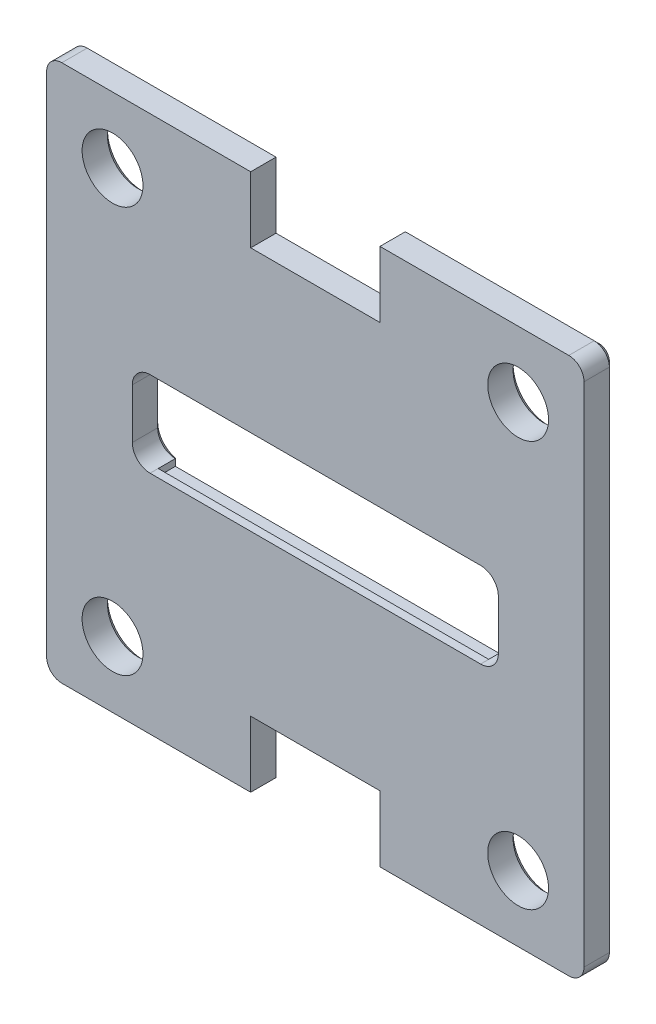
from build123d import *

# Parameters (mm, degrees)
SKETCH1_R           = 3
BOSS_EXTRUDE1_DEPTH = 3
SKETCH2_W           = 32.6
SKETCH2_H           = 9.75
CUT_EXTRUDE1_DEPTH  = 2.2
CHAMFER1_SIZE       = 0.5


with BuildPart() as part:
    # Sketch1 → Boss-Extrude1 (new body)
    with BuildSketch(Plane(origin=(0, 0, 0), x_dir=(0, 1, 0), z_dir=(0, 0, 1))):
        with BuildLine():
            Line((-26.5, 25), (-26.5, 6.375))
            Line((-26.5, 6.375), (-26, 6.375))
            Line((-26, 6.375), (-20, 6.375))
            Line((-20, 6.375), (-20, -6.375))
            Line((-20, -6.375), (-26, -6.375))
            Line((-26, -6.375), (-26.5, -6.375))
            Line((-26.5, -6.375), (-26.5, -25))
            ThreePointArc((-26.5, -25), (-26.060660172, -26.060660172), (-25, -26.5))
            Line((-25, -26.5), (25, -26.5))
            ThreePointArc((25, -26.5), (26.060660172, -26.060660172), (26.5, -25))
            Line((26.5, -25), (26.5, -6.375))
            Line((26.5, -6.375), (26, -6.375))
            Line((26, -6.375), (20, -6.375))
            Line((20, -6.375), (20, 6.375))
            Line((20, 6.375), (26, 6.375))
            Line((26, 6.375), (26.5, 6.375))
            Line((26.5, 6.375), (26.5, 25))
            ThreePointArc((26.5, 25), (26.060660172, 26.060660172), (25, 26.5))
            Line((25, 26.5), (-25, 26.5))
            ThreePointArc((-25, 26.5), (-26.060660172, 26.060660172), (-26.5, 25))
        make_face()
        with Locations((-20, 20)):
            Circle(SKETCH1_R, mode=Mode.SUBTRACT)
        with Locations((20, 20)):
            Circle(SKETCH1_R, mode=Mode.SUBTRACT)
        with Locations((20, -20)):
            Circle(SKETCH1_R, mode=Mode.SUBTRACT)
        with Locations((-20, -20)):
            Circle(SKETCH1_R, mode=Mode.SUBTRACT)
        with BuildLine():
            Line((-2.46, 18.05), (2.46, 18.05))
            ThreePointArc((2.46, 18.05), (3.697436867, 17.537436867), (4.21, 16.3))
            Line((4.21, 16.3), (4.21, -16.3))
            ThreePointArc((4.21, -16.3), (3.697436867, -17.537436867), (2.46, -18.05))
            Line((2.46, -18.05), (-2.46, -18.05))
            ThreePointArc((-2.46, -18.05), (-3.697436867, -17.537436867), (-4.21, -16.3))
            Line((-4.21, -16.3), (-4.21, 16.3))
            ThreePointArc((-4.21, 16.3), (-3.697436867, 17.537436867), (-2.46, 18.05))
        make_face(mode=Mode.SUBTRACT)
    extrude(amount=BOSS_EXTRUDE1_DEPTH)

    # Sketch2 → Cut-Extrude1 (cut)
    with BuildSketch(Plane(origin=(0, 0, 0), x_dir=(1, 0, 0), z_dir=(0, 0, -1))):
        Rectangle(SKETCH2_W, SKETCH2_H)
    extrude(amount=-CUT_EXTRUDE1_DEPTH, mode=Mode.SUBTRACT)

    # Chamfer1
    chamfer1_edges = [part.edges().sort_by_distance(p)[0] for p in [
        (0, 20, 0),
        (-6.375, 23.25, 0),
        (-15.6875, 26.5, 0),
        (-15.6875, -26.5, 0),
        (-6.375, -23.25, 0),
        (0, -20, 0),
        (6.375, -23.25, 0),
        (15.6875, -26.5, 0),
        (15.6875, 26.5, 0),
        (17.537436867, -3.697436867, 0),
        (-17.537436867, -3.697436867, 0),
        (18.05, 0, 0),
        (-18.05, 0, 0),
        (17.537436867, 3.697436867, 0),
        (-17.537436867, 3.697436867, 0),
        (-20, -23, 0),
        (20, -23, 0),
        (-20, 17, 0),
        (20, 17, 0),
        (-16.3, 4.5425, 0),
        (0, 4.875, 0),
        (16.3, 4.5425, 0),
        (-16.3, -4.5425, 0),
        (16.3, -4.5425, 0),
        (0, -4.875, 0),
        (6.375, 23.25, 0),
        (-26.060660172, -26.060660172, 0),
        (26.060660172, -26.060660172, 0),
        (-26.5, 0, 0),
        (26.5, 0, 0),
        (-26.060660172, 26.060660172, 0),
        (26.060660172, 26.060660172, 0),
    ]]
    chamfer(chamfer1_edges, length=CHAMFER1_SIZE)


solid = part.part
